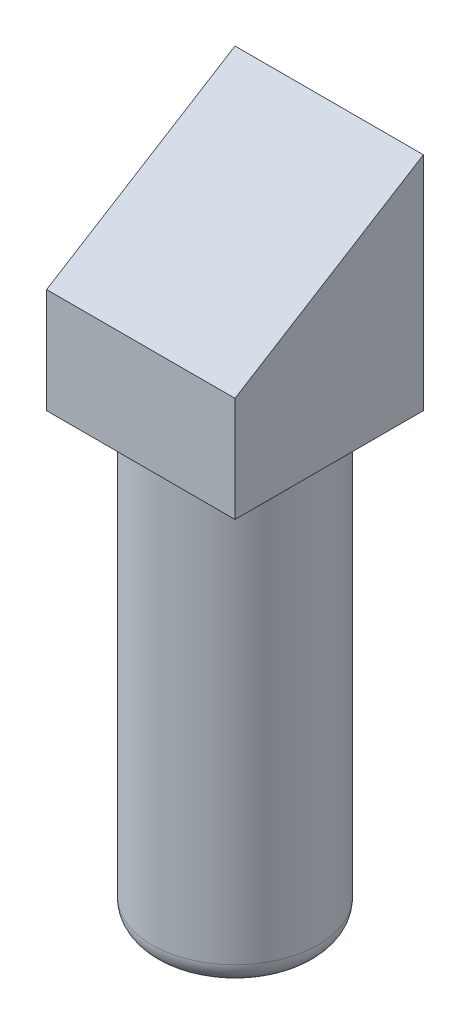
from build123d import *

# Parameters (mm, degrees)
SKETCH1_R           = 3.75
BOSS_EXTRUDE1_DEPTH = 20
SKETCH2_R           = 2.5
CUT_EXTRUDE1_DEPTH  = 20
SKETCH5_W           = 8.5
SKETCH5_H           = 8.5
BOSS_EXTRUDE3_DEPTH = 10
CUT_EXTRUDE4_DEPTH  = 30
FILLET5_R           = 1


with BuildPart() as part:
    # Sketch1 → Boss-Extrude1 (new body)
    with BuildSketch(Plane(origin=(0, 0, 0), x_dir=(1, 0, 0), z_dir=(0, 1, 0))):
        Circle(SKETCH1_R)
    extrude(amount=BOSS_EXTRUDE1_DEPTH)

    # Sketch2 → Cut-Extrude1 (cut)
    with BuildSketch(Plane.XZ):
        Circle(SKETCH2_R)
    extrude(amount=-CUT_EXTRUDE1_DEPTH, mode=Mode.SUBTRACT)

    # Sketch5 → Boss-Extrude3 (add)
    with BuildSketch(Plane(origin=(0, 20, 0), x_dir=(1, 0, 0), z_dir=(0, 1, 0))):
        Rectangle(SKETCH5_W, SKETCH5_H)
    extrude(amount=BOSS_EXTRUDE3_DEPTH)

    # Sketch19 → Cut-Extrude4 (cut)
    with BuildSketch(Plane.ZY.offset(4.25)):
        Polygon((-4.25, 30), (4.25, 30), (4.25, 24.732173124), align=None)
    extrude(amount=-CUT_EXTRUDE4_DEPTH, mode=Mode.SUBTRACT)

    # Fillet5
    fillet5_edges = [part.edges().sort_by_distance(p)[0] for p in [
        (-3.75, 0, 0),
    ]]
    fillet(fillet5_edges, radius=FILLET5_R)


solid = part.part
